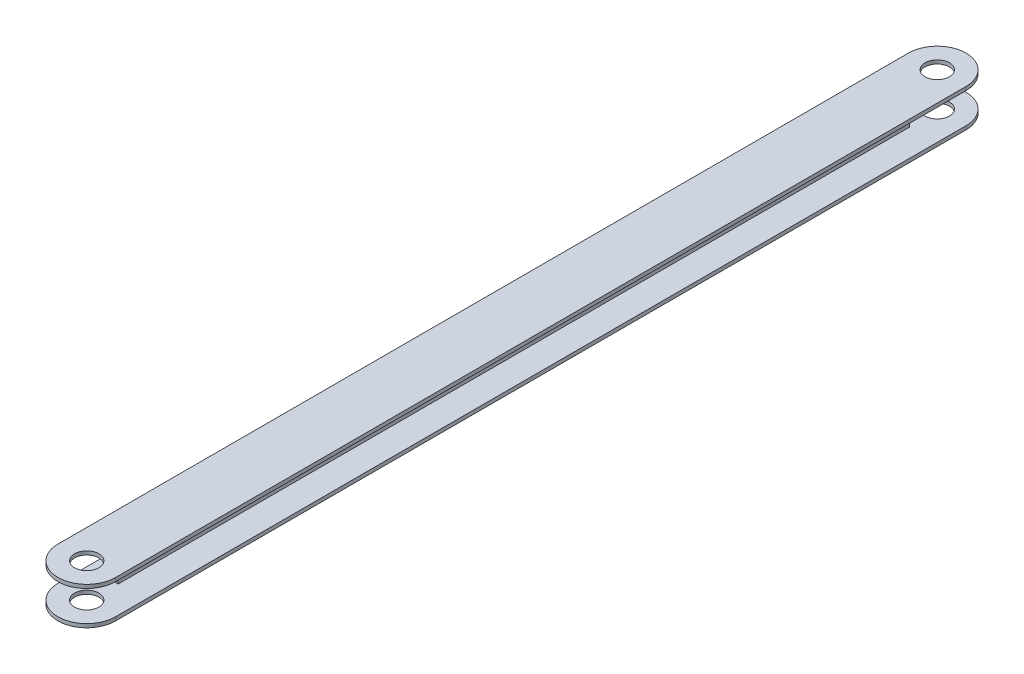
from build123d import *

# Parameters (mm, degrees)
BOSS_EXTRUDE1_DEPTH = 299
SKETCH3_R           = 4
CUT_EXTRUDE2_DEPTH  = 370
SKETCH6_W           = 19.5
SKETCH6_H           = 10
CUT_EXTRUDE4_DEPTH  = 370


with BuildPart() as part:
    # Sketch1 → Boss-Extrude1 (new body)
    with BuildSketch(Plane.XY):
        Polygon((-9.5, 5), (-0.6, 5), (-0.6, -5), (-9.5, -5), (-9.5, -6.2), (9.5, -6.2), (9.5, -5), (0.6, -5), (0.6, 5), (9.5, 5), (9.5, 6.2), (-9.5, 6.2), align=None)
    extrude(amount=BOSS_EXTRUDE1_DEPTH)

    # Sketch3 → Cut-Extrude2 (cut)
    with BuildSketch(Plane(origin=(0, 6.2, 0), x_dir=(1, 0, 0), z_dir=(0, 1, 0))):
        with BuildLine():
            ThreePointArc((14.5, -9.5), (0, 5), (-14.5, -9.5))
            Line((-14.5, -9.5), (-9.5, -9.5))
            ThreePointArc((-9.5, -9.5), (0, 0), (9.5, -9.5))
            Line((9.5, -9.5), (14.5, -9.5))
        make_face()
        with Locations((0, -9.5)):
            Circle(SKETCH3_R)
    cut_extrude2 = extrude(amount=-CUT_EXTRUDE2_DEPTH, mode=Mode.SUBTRACT)

    # Mirror1: Cut-Extrude2 across plane
    add(cut_extrude2.mirror(Plane.XY.offset(149.5)), mode=Mode.SUBTRACT)

    # Sketch6 → Cut-Extrude4 (cut)
    with BuildSketch(Plane.ZY.offset(0.6)):
        with Locations((9.5, 0)):
            Rectangle(SKETCH6_W, SKETCH6_H)
    cut_extrude4 = extrude(amount=-CUT_EXTRUDE4_DEPTH, mode=Mode.SUBTRACT)

    # Mirror3: Cut-Extrude4 across plane
    add(cut_extrude4.mirror(Plane.XY.offset(149.5)), mode=Mode.SUBTRACT)


solid = part.part
